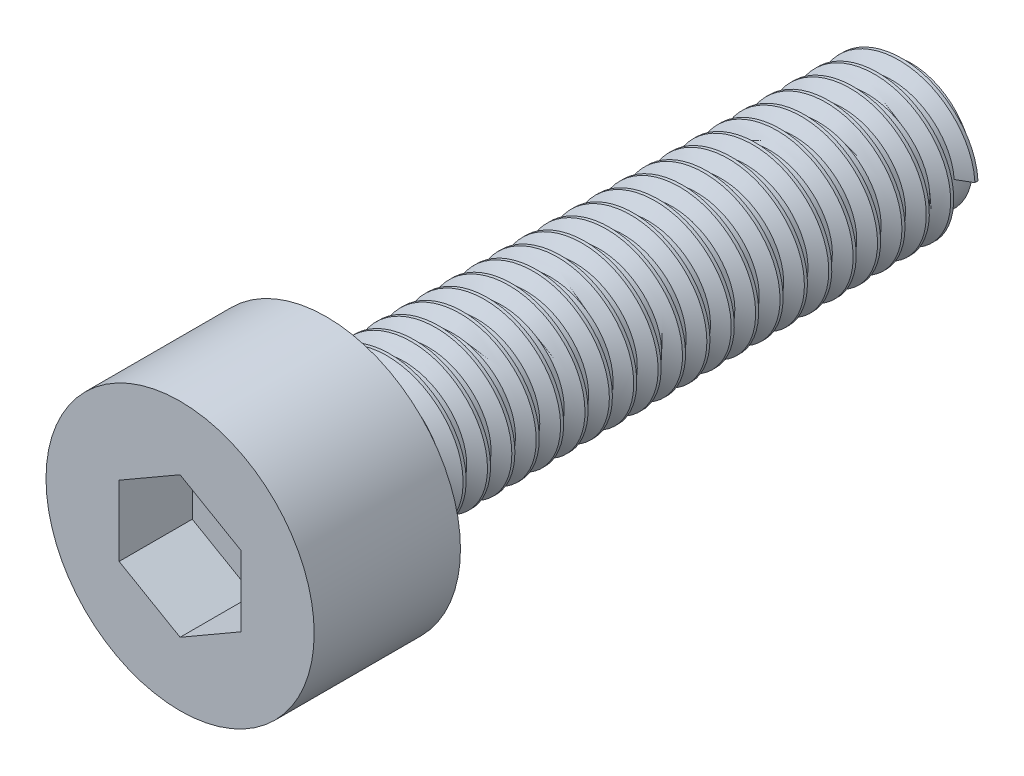
from build123d import *

# Parameters (mm, degrees)
SKETCH1_R           = 2.75
BOSS_EXTRUDE1_DEPTH = 3
SKETCH2_R           = 1.25
BOSS_EXTRUDE2_DEPTH = 12
CUT_EXTRUDE1_DEPTH  = 1.5
THREAD1_PITCH       = 0.5


with BuildPart() as part:
    # Sketch1 → Boss-Extrude1 (new body)
    with BuildSketch(Plane.XY):
        Circle(SKETCH1_R)
    extrude(amount=BOSS_EXTRUDE1_DEPTH)

    # Sketch2 → Boss-Extrude2 (add)
    with BuildSketch(Plane(origin=(0, 0, 0), x_dir=(-1, 0, 0), z_dir=(0, 0, -1))):
        Circle(SKETCH2_R)
    extrude(amount=BOSS_EXTRUDE2_DEPTH)

    # Sketch3 → Cut-Extrude1 (cut)
    with BuildSketch(Plane.XY.offset(3)):
        Polygon((0, 1.443375673), (-1.25, 0.721687836), (-1.25, -0.721687836), (0, -1.443375673), (1.25, -0.721687836), (1.25, 0.721687836), align=None)
    extrude(amount=-CUT_EXTRUDE1_DEPTH, mode=Mode.SUBTRACT)

    # Thread1: the profile of Thread Profile1 profile screwed along a right-hand helix of 24 turns, 6 arcs to a turn; built about Z, then put on its axis
    thread1_z = Axis((0, 0, 0), (0, 0, 1))
    thread1_corners = [(1.2497, 0, -0.000173205), (1.520632938, 0, 0.156249999), (1.520632937, 0, 0.218749999), (1.2497, 0, 0.375173204)]
    with BuildLine(mode=Mode.PRIVATE) as thread1_profile:
        Line(thread1_corners[0], thread1_corners[1])
        Line(thread1_corners[1], thread1_corners[2])
        Line(thread1_corners[2], thread1_corners[3])
        Line(thread1_corners[3], thread1_corners[0])
    thread1_cap = Face(thread1_profile.wire())
    thread1_turn_angles = [0, 30, 60, 90, 120, 150, 180, 210, 240, 270, 300, 330, 360]
    thread1_turn_weights = [1, 0.8660254037844387, 1, 0.8660254037844387, 1, 0.8660254037844387, 1, 0.8660254037844387, 1, 0.8660254037844387, 1, 0.8660254037844387, 1]
    thread1_turn_rails = [Edge.make_bspline([Vector(p[0], p[1], 0).rotate(thread1_z, thread1_turn_angles[k]) / thread1_turn_weights[k] + Vector(0, 0, p[2] + THREAD1_PITCH * thread1_turn_angles[k] / 360) for k in range(13)], [0, 0, 0, 1, 1, 2, 2, 3, 3, 4, 4, 5, 5, 6, 6, 6], 2, thread1_turn_weights) for p in thread1_corners]
    thread1_turn_sides = [Face.make_surface_from_curves(thread1_turn_rails[p[0]], thread1_turn_rails[p[1]]) for p in [(0, 1), (1, 2), (2, 3), (3, 0)]]
    thread1 = Plane(origin=(0, 0, -12), x_dir=(1, 0, 0), z_dir=(0, 0, 1)) * Solid(Shell([*[p.moved(Location((0, 0, THREAD1_PITCH * i))) for i in range(24) for p in thread1_turn_sides], thread1_cap, thread1_cap.rotate(thread1_z, 8640).moved(Location((0, 0, THREAD1_PITCH * 8640 / 360)))]))
    add(thread1)


solid = part.part
